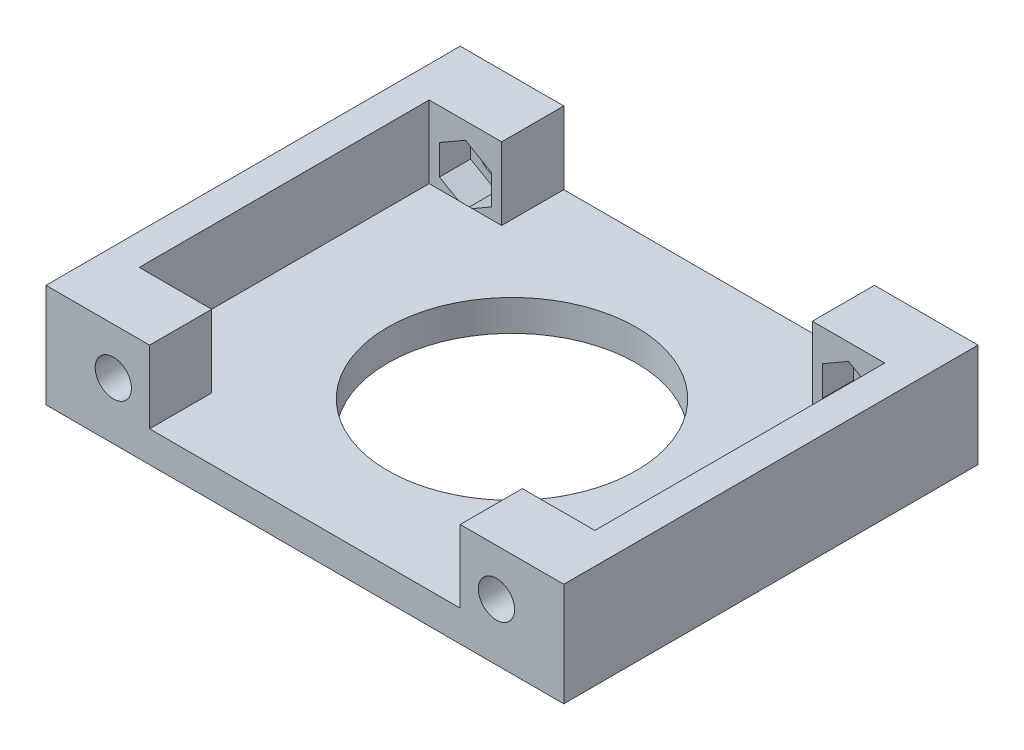
from build123d import *

# Parameters (mm, degrees)
SKETCH1_W            = 50
SKETCH1_H            = 40
BOSS_EXTRUDE1_DEPTH  = 3
SKETCH2_R            = 12
CUT_EXTRUDE1_DEPTH   = 33.155870382
SKETCH3_W            = 3
SKETCH3_H            = 40
BOSS_EXTRUDE2_DEPTH  = 7
SKETCH4_W            = 7
SKETCH4_H            = 7
BOSS_EXTRUDE3_DEPTH  = 6
SKETCH5_R            = 1.75
CUT_EXTRUDE2_DEPTH   = 49.218253805
CUT_EXTRUDE3_DEPTH   = 3
MIRROR3_COPY_1_DEPTH = 3
MIRROR3_COPY_2_DEPTH = 3


with BuildPart() as part:
    # Sketch1 → Boss-Extrude1 (new body)
    with BuildSketch(Plane(origin=(0, 0, 0), x_dir=(1, 0, 0), z_dir=(0, 1, 0))):
        Rectangle(SKETCH1_W, SKETCH1_H)
    extrude(amount=BOSS_EXTRUDE1_DEPTH)

    # Sketch2 → Cut-Extrude1 (cut, through all)
    with BuildSketch(Plane(origin=(0, 3, 0), x_dir=(1, 0, 0), z_dir=(0, 1, 0))):
        Circle(SKETCH2_R)
    extrude(amount=-CUT_EXTRUDE1_DEPTH, mode=Mode.SUBTRACT)

    # Sketch3 → Boss-Extrude2 (add)
    with BuildSketch(Plane(origin=(0, 3, 0), x_dir=(1, 0, 0), z_dir=(0, 1, 0))):
        with Locations((-23.5, 0)):
            Rectangle(SKETCH3_W, SKETCH3_H)
        with Locations((23.5, 0)):
            Rectangle(SKETCH3_W, SKETCH3_H)
    extrude(amount=BOSS_EXTRUDE2_DEPTH)

    # Sketch4 → Boss-Extrude3 (add)
    with BuildSketch(Plane.XY.offset(20)):
        with Locations((-18.5, 6.5)):
            Rectangle(SKETCH4_W, SKETCH4_H)
        with Locations((18.5, 6.5)):
            Rectangle(SKETCH4_W, SKETCH4_H)
    boss_extrude3 = extrude(amount=-BOSS_EXTRUDE3_DEPTH)

    # Sketch5 → Cut-Extrude2 (cut, through all)
    with BuildSketch(Plane.XY.offset(20)):
        with Locations((-18.5, 5.5)):
            Circle(SKETCH5_R)
        with Locations((18.5, 5.5)):
            Circle(SKETCH5_R)
    cut_extrude2 = extrude(amount=-CUT_EXTRUDE2_DEPTH, mode=Mode.SUBTRACT)

    # Mirror1: Boss-Extrude3, Cut-Extrude2 across plane
    add(boss_extrude3.mirror(Plane.XY))
    add(cut_extrude2.mirror(Plane.XY), mode=Mode.SUBTRACT)

    # Sketch6 → Cut-Extrude3 (cut)
    with BuildSketch(Plane.XY.offset(-14)):
        Polygon((-18.5, 2.613248654), (-16, 4.056624327), (-16, 6.943375673), (-18.5, 8.386751346), (-21, 6.943375673), (-21, 4.056624327), align=None)
    cut_extrude3 = extrude(amount=-CUT_EXTRUDE3_DEPTH, mode=Mode.SUBTRACT)

    # Mirror2: Cut-Extrude3 across plane
    add(cut_extrude3.mirror(Plane(origin=(0, 0, 0), x_dir=(0, 0, 1), z_dir=(1, 0, 0))), mode=Mode.SUBTRACT)

    # Mirror3 copy 1 sketch → Mirror3 copy 1 (cut)
    with BuildSketch(Plane(origin=(0, 0, 14), x_dir=(-1, 0, 0), z_dir=(0, 0, -1))):
        Polygon((-18.5, 2.613248654), (-16, 4.056624327), (-16, 6.943375673), (-18.5, 8.386751346), (-21, 6.943375673), (-21, 4.056624327), align=None)
    extrude(amount=-MIRROR3_COPY_1_DEPTH, mode=Mode.SUBTRACT)

    # Mirror3 copy 2 sketch → Mirror3 copy 2 (cut)
    with BuildSketch(Plane(origin=(0, 0, 14), x_dir=(1, 0, 0), z_dir=(0, 0, -1))):
        Polygon((-18.5, -2.613248654), (-16, -4.056624327), (-16, -6.943375673), (-18.5, -8.386751346), (-21, -6.943375673), (-21, -4.056624327), align=None)
    extrude(amount=-MIRROR3_COPY_2_DEPTH, mode=Mode.SUBTRACT)


solid = part.part
